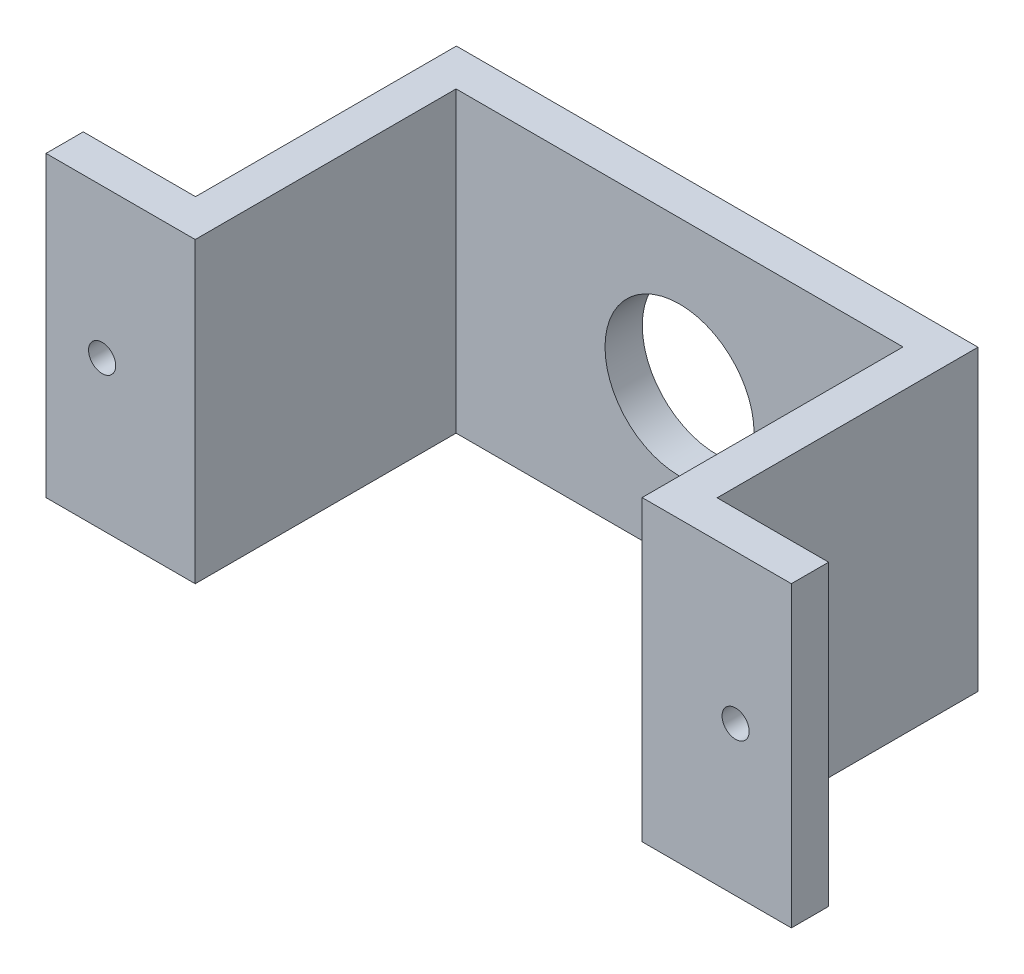
from build123d import *

# Parameters (mm, degrees)
SKETCH1_W           = 127
SKETCH1_H           = 50.8
BOSS_EXTRUDE1_DEPTH = 50.8
SKETCH2_W           = 18.996127276
SKETCH2_H           = 50.8
SKETCH2_W_2         = 19.127407137
CUT_EXTRUDE1_DEPTH  = 44.45
SKETCH3_W           = 76.151334044
SKETCH3_H           = 50.8
CUT_EXTRUDE2_DEPTH  = 44.45
SKETCH4_R           = 12.7
CUT_EXTRUDE3_DEPTH  = 44.45
SKETCH5_R           = 2.3114
CUT_EXTRUDE4_DEPTH  = 44.45
SKETCH6_R           = 2.3114
CUT_EXTRUDE5_DEPTH  = 44.45


with BuildPart() as part:
    # Sketch1 → Boss-Extrude1 (new body)
    with BuildSketch(Plane.XY):
        Rectangle(SKETCH1_W, SKETCH1_H)
    extrude(amount=BOSS_EXTRUDE1_DEPTH)

    # Sketch2 → Cut-Extrude1 (cut)
    with BuildSketch(Plane(origin=(0, 0, 0), x_dir=(-1, 0, 0), z_dir=(0, 0, -1))):
        with Locations((-54.001936362, 0)):
            Rectangle(SKETCH2_W, SKETCH2_H)
        with Locations((53.936296432, 0)):
            Rectangle(SKETCH2_W_2, SKETCH2_H)
    extrude(amount=-CUT_EXTRUDE1_DEPTH, mode=Mode.SUBTRACT)

    # Sketch3 → Cut-Extrude2 (cut)
    with BuildSketch(Plane.XY.offset(50.8)):
        Rectangle(SKETCH3_W, SKETCH3_H)
    extrude(amount=-CUT_EXTRUDE2_DEPTH, mode=Mode.SUBTRACT)

    # Sketch4 → Cut-Extrude3 (cut)
    with BuildSketch(Plane(origin=(0, 0, 0), x_dir=(-1, 0, 0), z_dir=(0, 0, -1))):
        Circle(SKETCH4_R)
    extrude(amount=-CUT_EXTRUDE3_DEPTH, mode=Mode.SUBTRACT)

    # Sketch5 → Cut-Extrude4 (cut)
    with BuildSketch(Plane(origin=(0, 0, 44.45), x_dir=(-1, 0, 0), z_dir=(0, 0, -1))):
        with Locations((-54.001936362, 0)):
            Circle(SKETCH5_R)
    extrude(amount=-CUT_EXTRUDE4_DEPTH, mode=Mode.SUBTRACT)

    # Sketch6 → Cut-Extrude5 (cut)
    with BuildSketch(Plane(origin=(0, 0, 44.45), x_dir=(-1, 0, 0), z_dir=(0, 0, -1))):
        with Locations((53.936296432, 0)):
            Circle(SKETCH6_R)
    extrude(amount=-CUT_EXTRUDE5_DEPTH, mode=Mode.SUBTRACT)


solid = part.part
